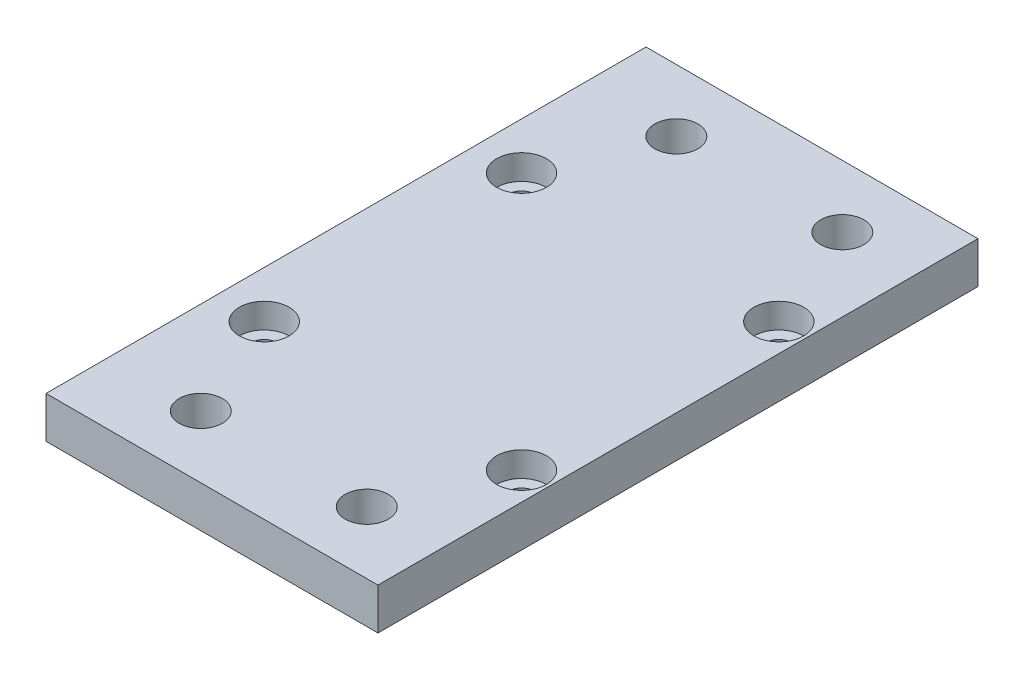
from build123d import *

# Parameters (mm, degrees)
SKETCH2_W           = 42.3
SKETCH2_H           = 72.3
SKETCH2_R           = 1.6
SKETCH2_R_2         = 2.6
BOSS_EXTRUDE1_DEPTH = 5
SKETCH3_R           = 3
CUT_EXTRUDE1_DEPTH  = 3
SKETCH5_W           = 2.3
SKETCH5_H           = 72.3
CUT_EXTRUDE2_DEPTH  = 43.179912281


with BuildPart() as part:
    # Sketch2 → Boss-Extrude1 (new body)
    with BuildSketch(Plane(origin=(0, 0, 0), x_dir=(1, 0, 0), z_dir=(0, 1, 0))):
        Rectangle(SKETCH2_W, SKETCH2_H)
        with Locations((-15.5, -15.5)):
            Circle(SKETCH2_R, mode=Mode.SUBTRACT)
        with Locations((15.5, -15.5)):
            Circle(SKETCH2_R, mode=Mode.SUBTRACT)
        with Locations((-15.5, 15.5)):
            Circle(SKETCH2_R, mode=Mode.SUBTRACT)
        with Locations((15.5, 15.5)):
            Circle(SKETCH2_R, mode=Mode.SUBTRACT)
        with Locations((10, 28.65)):
            Circle(SKETCH2_R_2, mode=Mode.SUBTRACT)
        with Locations((-10, 28.65)):
            Circle(SKETCH2_R_2, mode=Mode.SUBTRACT)
        with Locations((10, -28.65)):
            Circle(SKETCH2_R_2, mode=Mode.SUBTRACT)
        with Locations((-10, -28.65)):
            Circle(SKETCH2_R_2, mode=Mode.SUBTRACT)
    extrude(amount=BOSS_EXTRUDE1_DEPTH)

    # Sketch3 → Cut-Extrude1 (cut)
    with BuildSketch(Plane(origin=(0, 5, 0), x_dir=(1, 0, 0), z_dir=(0, 1, 0))):
        with Locations((-15.5, 15.5)):
            Circle(SKETCH3_R)
        with Locations((15.5, 15.5)):
            Circle(SKETCH3_R)
        with Locations((15.5, -15.5)):
            Circle(SKETCH3_R)
        with Locations((-15.5, -15.5)):
            Circle(SKETCH3_R)
    extrude(amount=-CUT_EXTRUDE1_DEPTH, mode=Mode.SUBTRACT)

    # Sketch5 → Cut-Extrude2 (cut, through all)
    with BuildSketch(Plane.XZ):
        with Locations((20, 0)):
            Rectangle(SKETCH5_W, SKETCH5_H)
    extrude(amount=-CUT_EXTRUDE2_DEPTH, mode=Mode.SUBTRACT)


solid = part.part
